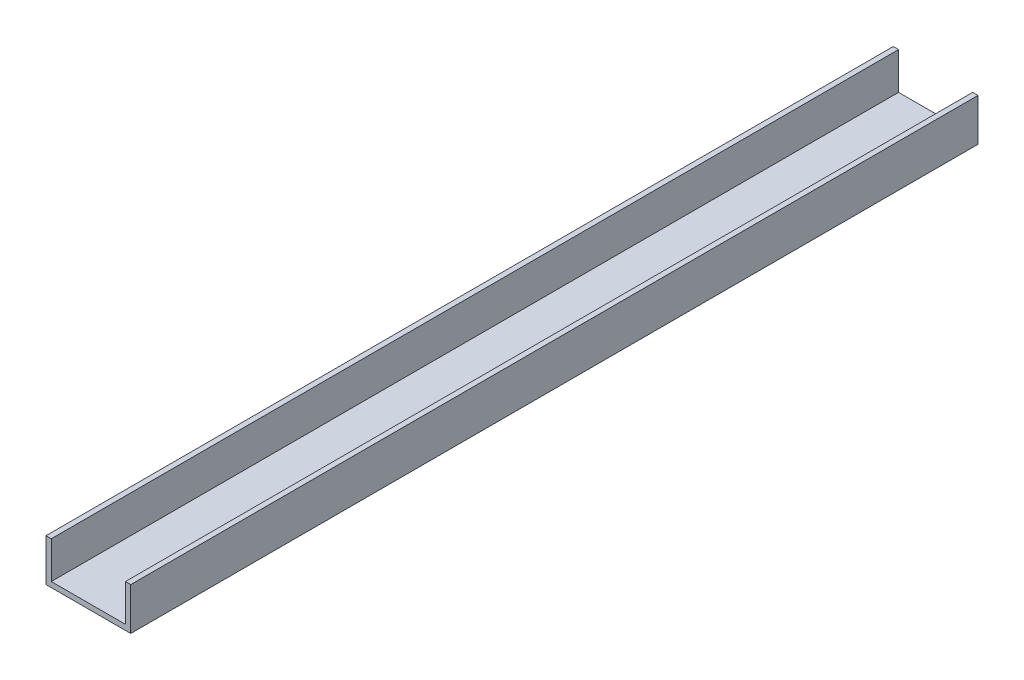
from build123d import *

# Parameters (mm, degrees)
BOSS_EXTRUDE1_DEPTH = 508


with BuildPart() as part:
    # Sketch1 → Boss-Extrude1 (new body)
    with BuildSketch(Plane.XY):
        Polygon((47.625, 3.175), (47.625, 25.4), (50.8, 25.4), (50.8, 0), (0, 0), (0, 25.4), (3.175, 25.4), (3.175, 3.175), align=None)
    extrude(amount=BOSS_EXTRUDE1_DEPTH)


solid = part.part
